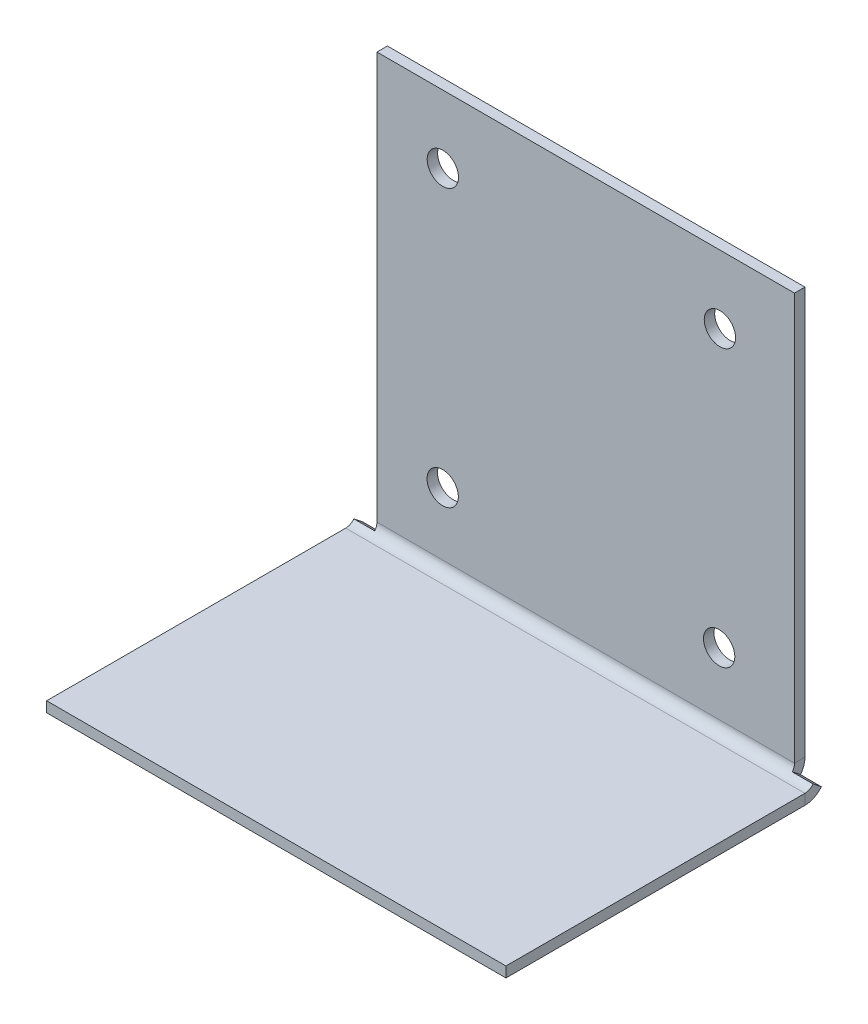
from build123d import *

# Parameters (mm, degrees)
BOSS_EXTRUDE4_DEPTH    = 1.6
CONVERT_SOLID6_DEPTH   = 0.6
SKETCHED_START         = -60.753452496
SKETCHED_BEND3_DEPTH   = 44
SKETCHED_BEND3_2_DEPTH = 2
SKETCHED_START_2       = -18.753452496
SKETCHED_BEND3_3_DEPTH = 2
SKETCHED_BEND3_4_DEPTH = 44
SKETCHED_START_3       = -58.753452496
SKETCHED_BEND3_5_DEPTH = 40
F_3_0MM_DOWEL_HOLE1_D  = 3
F_3_0MM_DOWEL_HOLE2_D  = 3
F_3_0MM_DOWEL_HOLE3_D  = 3
F_3_0MM_DOWEL_HOLE4_D  = 3


# Read off the part's stored shape, not the designer's step: Convert-Solid6, Sketched Bend3
with BuildPart() as part:
    # Sketch1 → Boss-Extrude4 (new body)
    with BuildSketch(Plane.XY):
        Polygon((-58.753452496, 23.769203004), (-18.753452496, 23.769203004), (-18.753452496, -16.230796996), (-16.753452496, -16.230796996), (-16.753452496, -46.230796996), (-60.753452496, -46.230796996), (-60.753452496, -16.230796996), (-58.753452496, -16.230796996), align=None)
    extrude(amount=BOSS_EXTRUDE4_DEPTH)

    # Convert-Solid6 outline → Convert-Solid6 (cut)
    with BuildSketch(Plane.XY):
        Polygon((-58.753452496, 23.769203004), (-58.753452496, -16.230796996), (-60.753452496, -16.230796996), (-60.753452496, -46.230796996), (-16.753452496, -46.230796996), (-16.753452496, -16.230796996), (-18.753452496, -16.230796996), (-18.753452496, 23.769203004), align=None)
    extrude(amount=CONVERT_SOLID6_DEPTH, mode=Mode.SUBTRACT)

    # Sketched Bend3 outline → Sketched Bend3 (cut)
    with BuildSketch(Plane.YZ.offset(SKETCHED_START)):
        with BuildLine():
            Line((-16.962847803, 1.6), (-46.230796996, 1.6))
            Line((-46.230796996, 1.6), (-46.230796996, 0.6))
            Line((-46.230796996, 0.6), (-15.230796996, 0.6))
            ThreePointArc((-15.230796996, 0.6), (-16.230796996, 0.867949193), (-16.962847803, 1.6))
        make_face()
    extrude(amount=SKETCHED_BEND3_DEPTH, mode=Mode.SUBTRACT)

    # Sketched Bend3 2 outline → Sketched Bend3 2 (cut)
    with BuildSketch(Plane.YZ.offset(SKETCHED_START)):
        with BuildLine():
            Line((-16.230796996, 1.329098256), (-16.467536602, 1.028225479))
            ThreePointArc((-16.467536602, 1.028225479), (-16.35203432, 0.9438518), (-16.230796996, 0.867949193))
            Line((-16.230796996, 0.867949193), (-16.230796996, 1.329098256))
        make_face()
    extrude(amount=SKETCHED_BEND3_2_DEPTH, mode=Mode.SUBTRACT)

    # Sketched Bend3 3 outline → Sketched Bend3 3 (cut)
    with BuildSketch(Plane.YZ.offset(SKETCHED_START_2)):
        with BuildLine():
            Line((-16.230796996, 1.329098256), (-16.467536602, 1.028225479))
            ThreePointArc((-16.467536602, 1.028225479), (-16.35203432, 0.9438518), (-16.230796996, 0.867949193))
            Line((-16.230796996, 0.867949193), (-16.230796996, 1.329098256))
        make_face()
    extrude(amount=SKETCHED_BEND3_3_DEPTH, mode=Mode.SUBTRACT)

    # Sketched Bend3 4 outline → Sketched Bend3 4 (add)
    with BuildSketch(Plane.YZ.offset(SKETCHED_START)):
        with BuildLine():
            Line((-16.230796996, 31.24380551), (-17.230796996, 31.24380551))
            Line((-17.230796996, 31.24380551), (-17.230796996, 2.6))
            ThreePointArc((-17.230796996, 2.6), (-17.162648648, 2.08236191), (-16.962847803, 1.6))
            Line((-16.962847803, 1.6), (-16.230796996, 1.6))
            Line((-16.230796996, 1.6), (-16.230796996, 1.329098256))
            Line((-16.230796996, 1.329098256), (-15.849166799, 1.814112739))
            ThreePointArc((-15.849166799, 1.814112739), (-16.130344049, 2.163176124), (-16.230796996, 2.6))
            Line((-16.230796996, 2.6), (-16.230796996, 31.24380551))
        make_face()
    extrude(amount=SKETCHED_BEND3_4_DEPTH)

    # Sketched Bend3 5 outline → Sketched Bend3 5 (add)
    with BuildSketch(Plane.YZ.offset(SKETCHED_START_3)):
        with BuildLine():
            ThreePointArc((-15.230796996, 1.6), (-15.557991693, 1.655043054), (-15.849166799, 1.814112739))
            Line((-15.849166799, 1.814112739), (-16.017639885, 1.6))
            Line((-16.017639885, 1.6), (-15.230796996, 1.6))
        make_face()
    extrude(amount=SKETCHED_BEND3_5_DEPTH)

    # Ø3.0mm Dowel Hole1 (through all)
    with Locations(Plane(origin=(-8.856923846, -7.992050606, 0.6), x_dir=(1, 0, 0), z_dir=(0, 0, -1))):
        with Locations((-43.60055999, 1.230399912)):
            Hole(F_3_0MM_DOWEL_HOLE1_D / 2)

    # Ø3.0mm Dowel Hole2 (through all)
    with Locations(Plane(origin=(-8.856923846, -7.992050606, 0.6), x_dir=(1, 0, 0), z_dir=(0, 0, -1))):
        with Locations((-17.11602881, 1.265852801)):
            Hole(F_3_0MM_DOWEL_HOLE2_D / 2)

    # Ø3.0mm Dowel Hole3 (through all)
    with Locations(Plane(origin=(-8.856923846, -7.992050606, 0.6), x_dir=(1, 0, 0), z_dir=(0, 0, -1))):
        with Locations((-43.586196393, -25.265955548)):
            Hole(F_3_0MM_DOWEL_HOLE3_D / 2)

    # Ø3.0mm Dowel Hole4 (through all)
    with Locations(Plane(origin=(-8.856923846, -7.992050606, 0.6), x_dir=(1, 0, 0), z_dir=(0, 0, -1))):
        with Locations((-17.044209907, -25.235902464)):
            Hole(F_3_0MM_DOWEL_HOLE4_D / 2)


solid = part.part
